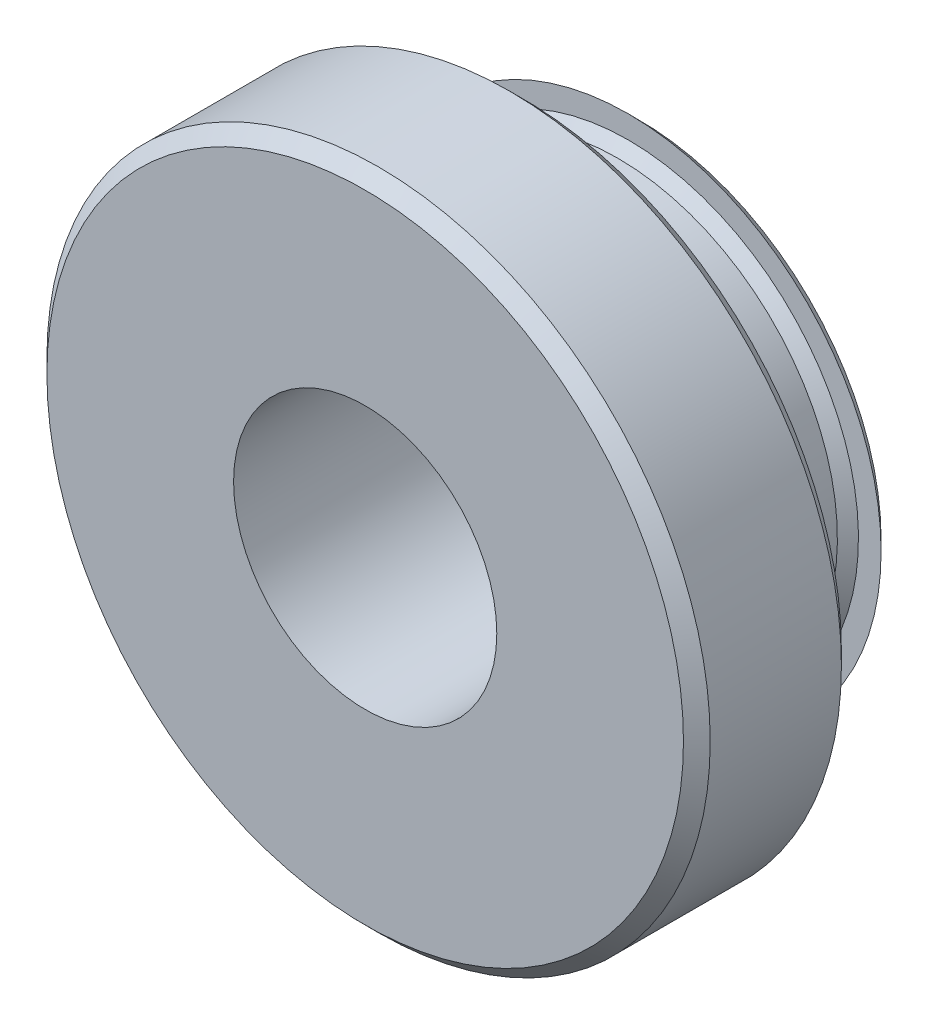
from build123d import *

# Parameters (mm, degrees)
SKETCH1_R           = 3.15
EXTRUDE1_DEPTH      = 1.5
SKETCH2_R           = 2.2051
EXTRUDE2_DEPTH      = 1.1
CHAMFER2_SIZE       = 0.127
SKETCH_2_R          = 2.6
EXTRUDE_1_DEPTH     = 2.6
SKETCH_1_R          = 1.25
CUT_EXTRUDE_1_DEPTH = 10
SKETCH_3_R          = 2.75
SKETCH_3_R_2        = 2.085
CUT_EXTRUDE_2_DEPTH = 1
CHAMFER_2_SIZE      = 0.1
CHAMFER_3_SIZE      = 0.3
CHAMFER_4_SIZE      = 0.3
SKETCH_6_R          = 1.25
EXTRUDE_2_DEPTH     = 3.2
HOLE_WIZARD_M31_D   = 2.5


with BuildPart() as part:
    # Sketch1 → Extrude1 (new body)
    with BuildSketch(Plane.XY):
        Circle(SKETCH1_R)
    extrude(amount=-EXTRUDE1_DEPTH)

    # Sketch2 → Extrude2 (add)
    with BuildSketch(Plane(origin=(0, 0, -1.5), x_dir=(-1, 0, 0), z_dir=(0, 0, -1))):
        with Locations(Location((0, 0, 0), (0, 0, 180))):
            Circle(SKETCH2_R)
    extrude(amount=EXTRUDE2_DEPTH)

    # Chamfer2
    chamfer2_edges = [part.edges().sort_by_distance(p)[0] for p in [
        (-3.15, 0, 0),
        (-3.15, 0, -1.5),
    ]]
    chamfer(chamfer2_edges, length=CHAMFER2_SIZE)

    # Эскиз2 → Бобышка-Вытянуть1 (add)
    with BuildSketch(Plane.XY):
        Circle(SKETCH_2_R)
    extrude(amount=-EXTRUDE_1_DEPTH)

    # Эскиз1 → Вырез-Вытянуть1 (cut)
    with BuildSketch(Plane.XY):
        Circle(SKETCH_1_R)
    extrude(amount=-CUT_EXTRUDE_1_DEPTH, mode=Mode.SUBTRACT)

    # Эскиз3 → Вырез-Вытянуть2 (cut)
    with BuildSketch(Plane(origin=(0, 0, -1.5), x_dir=(-1, 0, 0), z_dir=(0, 0, -1))):
        Circle(SKETCH_3_R)
        with Locations(Location((0, 0, 0), (0, 0, 90))):
            Circle(SKETCH_3_R_2, mode=Mode.SUBTRACT)
    extrude(amount=CUT_EXTRUDE_2_DEPTH, mode=Mode.SUBTRACT)

    # Фаска2
    chamfer_2_edges = [part.edges().sort_by_distance(p)[0] for p in [
        (0, -2.085, -2.5),
    ]]
    chamfer(chamfer_2_edges, length=CHAMFER_2_SIZE)

    # Фаска3
    # the kernel refuses this chamfer: 0.3 mm, written as the material it takes off along each edge
    with BuildSketch(Plane(origin=(0, 0, -2.6), x_dir=(1, 0, 0), z_dir=(0, -1, 0))) as chamfer_3_piece_1:
        Polygon((2.6, CHAMFER_3_SIZE), (2.6 - CHAMFER_3_SIZE, 0), (2.6, 0), align=None)
    revolve(axis=Axis((0, 0, -2.6), (0, 0, 1)), mode=Mode.SUBTRACT)

    # Фаска4
    chamfer_4_edges = [part.edges().sort_by_distance(p)[0] for p in [
        (-1.25, 0, -2.6),
    ]]
    chamfer(chamfer_4_edges, length=CHAMFER_4_SIZE)

    # Эскиз6 → Бобышка-Вытянуть2 (add)
    with BuildSketch(Plane.XY):
        Circle(SKETCH_6_R)
    extrude(amount=-EXTRUDE_2_DEPTH)

    # Отверстие обработанное метчиком M31 (through all)
    with Locations(Plane.XY):
        with Locations((0, 0)):
            Hole(HOLE_WIZARD_M31_D / 2)


solid = part.part
